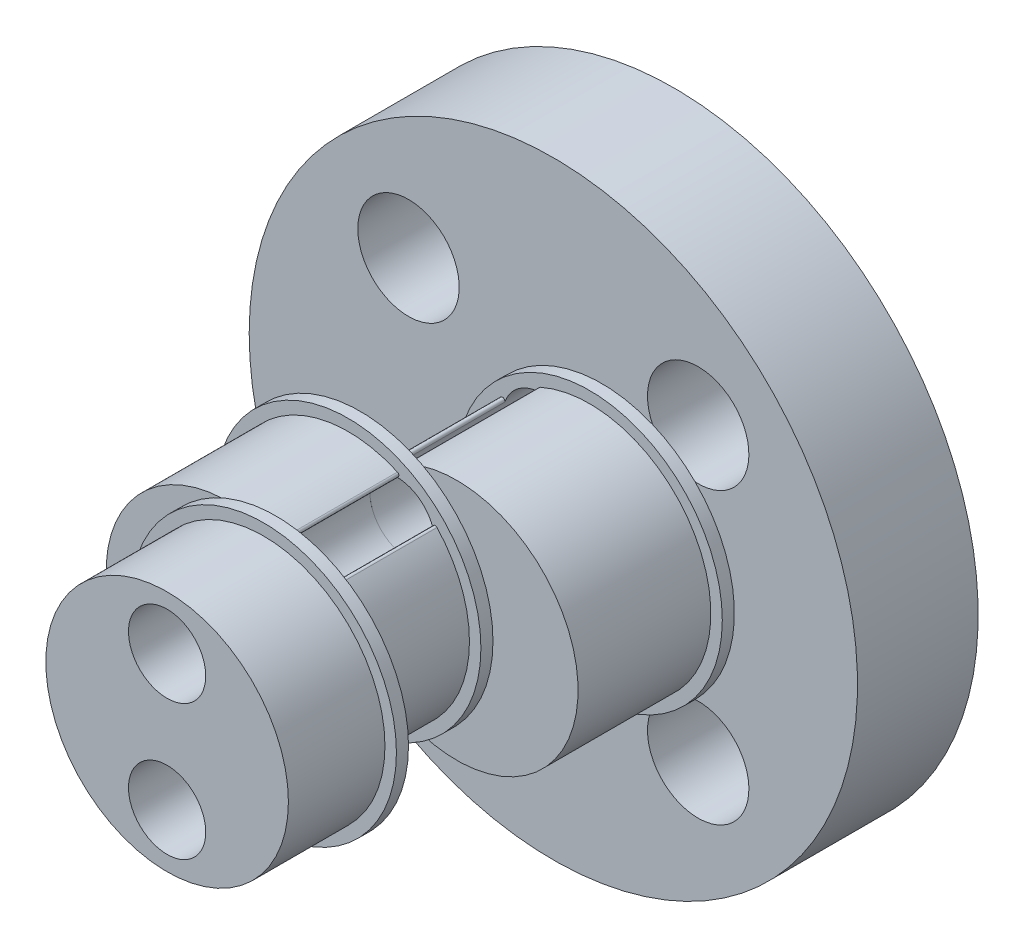
from build123d import *

# Parameters (mm, degrees)
SKETCH1_R            = 12.6
BOSS_EXTRUDE1_DEPTH  = 5
SKETCH2_R            = 5.499454457575955
SKETCH2_R_2          = 5.0249999999999995
BOSS_EXTRUDE2_DEPTH  = 0.5
SKETCH2_3_R          = 5.0249999999999995
BOSS_EXTRUDE3_DEPTH  = 6
BOSS_EXTRUDE4_START  = 6
SKETCH3_R            = 5.5
SKETCH3_R_2          = 5.0249999999999995
BOSS_EXTRUDE4_DEPTH  = 0.5
BOSS_EXTRUDE5_START  = 6
SKETCH3_3_R          = 5.0249999999999995
BOSS_EXTRUDE5_DEPTH  = 5.5
BOSS_EXTRUDE6_START  = 11.5
SKETCH4_R            = 5.5
SKETCH4_R_2          = 5.0249999999999995
BOSS_EXTRUDE6_DEPTH  = 0.5
BOSS_EXTRUDE7_START  = 11.5
SKETCH4_7_R          = 5.0249999999999995
BOSS_EXTRUDE7_DEPTH  = 4.5
SKETCH5_R            = 1.6000000000000003
CUT_EXTRUDE1_DEPTH   = 28.541241802068402
SPLIT1_START         = 9
SPLIT1_OUTLINE_R     = 1.6
SPLIT1_DEPTH         = 10
SPLIT1_2_DEPTH       = 5.5
SPLIT1_3_OUTLINE_R   = 5.5
SPLIT1_3_DEPTH       = 0.5
SPLIT1_START_2       = 14.5
SPLIT1_4_OUTLINE_R   = 5.025
SPLIT1_4_OUTLINE_R_2 = 1.6
SPLIT1_4_DEPTH       = 4.5
SPLIT1_5_OUTLINE_R   = 5.5
SPLIT1_5_OUTLINE_R_2 = 5.025
SPLIT1_5_DEPTH       = 0.5
FILLET1_R            = 0.1
FILLET2_R            = 0.1
CUT_EXTRUDE2_DEPTH   = 3.2
SKETCH7_R            = 2.1000000000000005
SKETCH7_R_2          = 2.099999999999999
SKETCH7_R_3          = 2.1000000000000014
CUT_EXTRUDE3_DEPTH   = 5


# Read off the part's stored shape, not the designer's step: Split1
with BuildPart() as part:
    # Sketch1 → Boss-Extrude1 (new body)
    with BuildSketch(Plane(origin=(0, 0, -2), x_dir=(-1, 0, 0), z_dir=(0, 0, -1))):
        Circle(SKETCH1_R)
    extrude(amount=-BOSS_EXTRUDE1_DEPTH)

    # Sketch2 → Boss-Extrude2 (add)
    with BuildSketch(Plane.XY.offset(3)):
        with Locations(Location((2, 0, 0), (0, 0, 180))):
            Circle(SKETCH2_R)
        with Locations((2, 0)):
            Circle(SKETCH2_R_2, mode=Mode.SUBTRACT)
    extrude(amount=BOSS_EXTRUDE2_DEPTH)

    # Sketch2<3> → Boss-Extrude3 (add)
    with BuildSketch(Plane.XY.offset(3)):
        with Locations((2, 0)):
            Circle(SKETCH2_3_R)
    extrude(amount=BOSS_EXTRUDE3_DEPTH)



with BuildPart() as body_2:
    # Sketch3 → Boss-Extrude4 (new body)
    with BuildSketch(Plane.XY.offset(3).offset(BOSS_EXTRUDE4_START)):
        with Locations((-2, -2.4e-16)):
            Circle(SKETCH3_R)
        with Locations((-2, -2.4e-16)):
            Circle(SKETCH3_R_2, mode=Mode.SUBTRACT)
    extrude(amount=BOSS_EXTRUDE4_DEPTH)


with BuildPart() as part_1:
    add(part.part)

    add(body_2.part)  # Boss-Extrude5 merges body 2
    # Sketch3<3> → Boss-Extrude5 (add)
    with BuildSketch(Plane.XY.offset(3).offset(BOSS_EXTRUDE5_START)):
        with Locations((-2, -2.4e-16)):
            Circle(SKETCH3_3_R)
    extrude(amount=BOSS_EXTRUDE5_DEPTH)

    # Sketch4 → Boss-Extrude6 (add)
    with BuildSketch(Plane.XY.offset(3).offset(BOSS_EXTRUDE6_START)):
        with Locations(Location((0, 0, 0), (0, 0, 114.145956113))):
            Circle(SKETCH4_R)
        with Locations(Location((0, 0, 0), (0, 0, 101.478778724))):
            Circle(SKETCH4_R_2, mode=Mode.SUBTRACT)
    extrude(amount=BOSS_EXTRUDE6_DEPTH)

    # Sketch4<7> → Boss-Extrude7 (add)
    with BuildSketch(Plane.XY.offset(3).offset(BOSS_EXTRUDE7_START)):
        Circle(SKETCH4_7_R)
    extrude(amount=BOSS_EXTRUDE7_DEPTH)

    # Sketch5 → Cut-Extrude1 (cut, through all)
    with BuildSketch(Plane.XY.offset(19)):
        with Locations((2e-17, 2.8)):
            Circle(SKETCH5_R)
        with Locations((7.1e-16, -2.8)):
            Circle(SKETCH5_R)
    extrude(amount=-CUT_EXTRUDE1_DEPTH, mode=Mode.SUBTRACT)

    # Split1 outline → Split1 (cut)
    with BuildSketch(Plane.XY.offset(SPLIT1_START)):
        with BuildLine():
            ThreePointArc((-1, 5.408326913), (-7.5, 0), (-1, -5.408326913))
            ThreePointArc((-1, -5.408326913), (5.5, 0), (-1, 5.408326913))
        make_face()
        with Locations((0, 2.8)):
            Circle(SPLIT1_OUTLINE_R, mode=Mode.SUBTRACT)
        with Locations((0, -2.8)):
            Circle(SPLIT1_OUTLINE_R, mode=Mode.SUBTRACT)
    extrude(amount=SPLIT1_DEPTH, mode=Mode.SUBTRACT)

    # Fillet2
    fillet2_edges = [part_1.edges().sort_by_distance(p)[0] for p in [
        (-0.6950501563684846, -4.241147209736796, 6.25),
        (-1.1378256882261084, -3.9248789726956352, 6.25),
        (-1.1378256882260929, 3.924878972695648, 6.25),
        (-0.6950501563685023, 4.241147209736784, 6.25),
    ]]
    fillet(fillet2_edges, radius=FILLET2_R)

    # Sketch6 → Cut-Extrude2 (cut)
    with BuildSketch(Plane(origin=(0, 0, -2), x_dir=(-1, 0, 0), z_dir=(0, 0, -1))):
        with BuildLine():
            Line((2.8, 2.8), (2.799999999999999, -2.8))
            ThreePointArc((2.799999999999999, -2.8), (-1.22e-15, -5.6), (-2.8000000000000007, -2.8))
            Line((-2.8000000000000007, -2.8), (-2.8, 2.8))
            ThreePointArc((-2.8, 2.8), (1.5e-16, 5.6), (2.8, 2.8))
        make_face()
    extrude(amount=-CUT_EXTRUDE2_DEPTH, mode=Mode.SUBTRACT)

    # Sketch7 → Cut-Extrude3 (cut)
    with BuildSketch(Plane(origin=(0, 0, -2), x_dir=(-1, 0, 0), z_dir=(0, 0, -1))):
        with Locations((-6.000000000000002, 5.999999999999999)):
            Circle(SKETCH7_R)
        with Locations((5.999999999999998, 5.999999999999999)):
            Circle(SKETCH7_R)
        with Locations((5.999999999999998, -6.000000000000001)):
            Circle(SKETCH7_R_2)
        with Locations((-6.000000000000003, -6)):
            Circle(SKETCH7_R_3)
    extrude(amount=-CUT_EXTRUDE3_DEPTH, mode=Mode.SUBTRACT)


with BuildPart() as body_2_2:
    # Split1 2 outline → Split1 2 (new body)
    with BuildSketch(Plane.XY.offset(SPLIT1_START)):
        with BuildLine():
            ThreePointArc((1.137825688, -3.924878973), (3.025, 0), (1.137825688, 3.924878973))
            ThreePointArc((1.137825688, 3.924878973), (-0.92998111, 1.498026446), (0.695050156, 4.24114721))
            ThreePointArc((0.695050156, 4.24114721), (-7.025, 0), (0.695050156, -4.24114721))
            ThreePointArc((0.695050156, -4.24114721), (-0.92998111, -1.498026446), (1.137825688, -3.924878973))
        make_face()
    extrude(amount=SPLIT1_2_DEPTH)

    # Split1 3 outline → Split1 3 (add)
    with BuildSketch(Plane.XY.offset(SPLIT1_START)):
        with Locations((-2, 0)):
            Circle(SPLIT1_3_OUTLINE_R)
        with BuildLine():
            ThreePointArc((0.695050156, 4.24114721), (0.92998111, 4.101973554), (1.137825688, 3.924878973))
            ThreePointArc((1.137825688, 3.924878973), (3.025, 0), (1.137825688, -3.924878973))
            ThreePointArc((1.137825688, -3.924878973), (0.92998111, -4.101973554), (0.695050156, -4.24114721))
            ThreePointArc((0.695050156, -4.24114721), (-7.025, 0), (0.695050156, 4.24114721))
        make_face(mode=Mode.SUBTRACT)
    extrude(amount=SPLIT1_3_DEPTH)

    # Fillet1
    # the kernel refuses this fillet: 0.1 mm, written as the material it takes off along each edge
    with BuildSketch(Plane(origin=(1.1378256880000006, -3.924878973, 9.5), x_dir=(0.5272838464707954, 0.8496892050926401, 0), z_dir=(0, 0, 1))) as fillet1_piece_1:
        with BuildLine():
            CenterArc((0.7339208558356513, -0.09749554475196075), FILLET1_R, 102.8500510005881, 156.06997269077794)
            Line((0.7147029545095785, -0.19563153340353207), (0.7143185964830571, -0.19759425317656348))
            ThreePointArc((0.7143185964830571, -0.19759425317656348), (0.3532125240431902, -0.1129366525704308), (-0.00066881691387395, -0.00188485647615828))
            Line((-0.00066881691387395, -0.00188485647615828), (0.00044480051866812, 0.00194991089503923))
            ThreePointArc((0.00044480051866812, 0.00194991089503923), (0.35584041495112406, -0.03807128397050696), (0.7112360293835808, 0.00194991089503922))
            Line((0.7112360293835808, 0.00194991089503922), (0.7116808299022489, -4e-17))
        make_face()
    extrude(amount=5, mode=Mode.SUBTRACT)
    with BuildSketch(Plane(origin=(0.6950501559999995, -4.241147210000001, 9.5), x_dir=(-0.9747710361649122, -0.22320713934366773, 0), z_dir=(0, 0, 1))) as fillet1_piece_2:
        with BuildLine():
            CenterArc((0.7339208553218103, 0.09749554475551281), FILLET1_R, 101.07997632228573, 156.06997268627677)
            Line((0.714702953972355, 0.19563153340250483), (0.7143185959453658, 0.1975942531754444))
            ThreePointArc((0.7143185959453658, 0.1975942531754444), (0.35321252377659246, 0.11293665255128191), (-0.00066881691414123, 0.00188485647606383))
            Line((-0.00066881691414123, 0.00188485647606383), (0.00044480051835665, -0.00194991089511022))
            ThreePointArc((0.00044480051835665, -0.00194991089511022), (0.35584041470198946, 0.03807128391367618), (0.711236028885622, -0.00194991089511051))
            Line((0.711236028885622, -0.00194991089511051), (0.7116808294039787, 0))
        make_face()
    extrude(amount=5, mode=Mode.SUBTRACT)
    with BuildSketch(Plane(origin=(0.6950501560000002, 4.24114721, 9.5), x_dir=(-0.8812560463152725, 0.4726391655721877, 0), z_dir=(0, 0, 1))) as fillet1_piece_3:
        with BuildLine():
            CenterArc((0.7336208593975166, 0.09972781848774585), FILLET1_R, 118.15832442623193, 156.06997268627686)
            Line((0.6864298993019216, 0.18789251258496353), (0.6854860801000094, 0.1896558064669081))
            ThreePointArc((0.6854860801000094, 0.1896558064669081), (0.35326623794808576, 0.05722576797323723), (-8.578182782469e-05, 0.00199815952266453))
            Line((-8.578182782469e-05, 0.00199815952266453), (-0.00014746147927519, -0.00199455636975523))
            ThreePointArc((-0.00014746147927519, -0.00199455636975523), (0.37049696668064286, -0.01567712099081798), (0.7411413948405625, -0.00199455636975463))
            Line((0.7411413948405625, -0.00199455636975463), (0.7409939333612872, 0))
        make_face()
    extrude(amount=5, mode=Mode.SUBTRACT)
    with BuildSketch(Plane(origin=(1.1378256880000008, 3.924878973, 9.5), x_dir=(0.7329038743989365, -0.6803322062720741, 0), z_dir=(0, 0, 1))) as fillet1_piece_4:
        with BuildLine():
            CenterArc((0.7336208599111411, -0.09972781848739057), FILLET1_R, 85.77170288473079, 156.06997269077783)
            Line((0.6864298998182243, -0.1878925125860417), (0.6854860806163661, -0.18965580646801475))
            ThreePointArc((0.6854860806163661, -0.18965580646801475), (0.35326623821426095, -0.05722576791705115), (-8.578182712573e-05, -0.00199815952269459))
            Line((-8.578182712573e-05, -0.00199815952269459), (-0.00014746147937158, 0.00199455636974773))
            ThreePointArc((-0.00014746147937158, 0.00199455636974773), (0.3704969669398584, 0.01567712100932383), (0.7411413953590879, 0.00199455636974782))
            Line((0.7411413953590879, 0.00199455636974782), (0.7409939338797163, 3e-17))
        make_face()
    extrude(amount=5, mode=Mode.SUBTRACT)


with BuildPart() as body_3:
    # Split1 4 outline → Split1 4 (new body)
    with BuildSketch(Plane.XY.offset(SPLIT1_START_2)):
        Circle(SPLIT1_4_OUTLINE_R)
        with Locations((0, -2.8)):
            Circle(SPLIT1_4_OUTLINE_R_2, mode=Mode.SUBTRACT)
        with Locations((0, 2.8)):
            Circle(SPLIT1_4_OUTLINE_R_2, mode=Mode.SUBTRACT)
    extrude(amount=SPLIT1_4_DEPTH)

    # Split1 5 outline → Split1 5 (add)
    with BuildSketch(Plane.XY.offset(SPLIT1_START_2)):
        Circle(SPLIT1_5_OUTLINE_R)
        Circle(SPLIT1_5_OUTLINE_R_2, mode=Mode.SUBTRACT)
    extrude(amount=SPLIT1_5_DEPTH)


solid = Compound([part_1.part, body_2_2.part, body_3.part])
